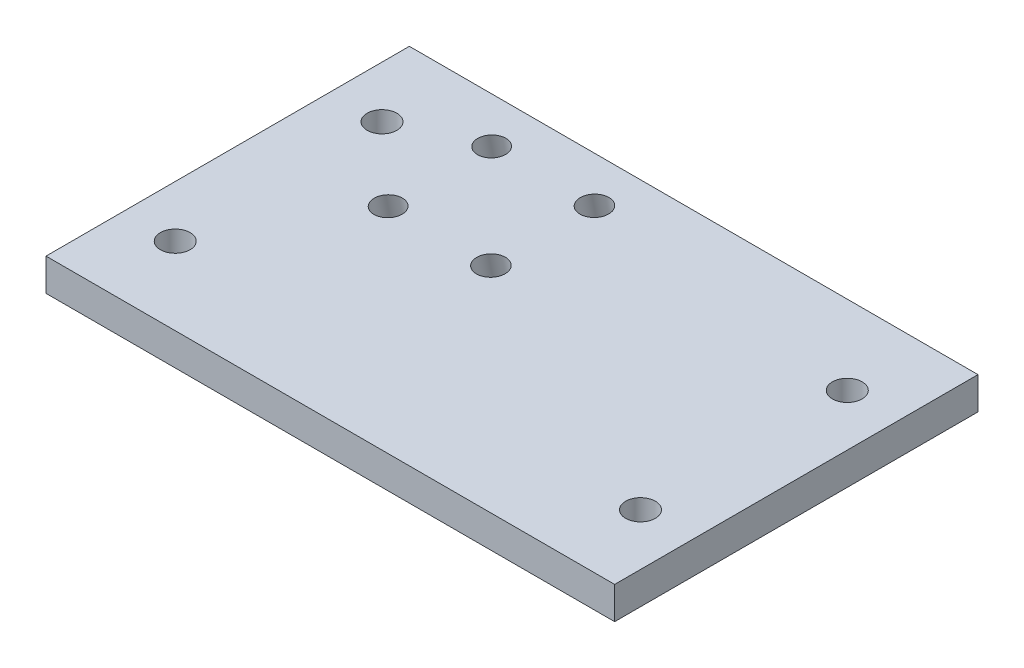
from build123d import *

# Parameters (mm, degrees)
SKETCH1_W           = 90
SKETCH1_H           = 56.23
BOSS_EXTRUDE1_DEPTH = 5
SKETCH2_R           = 2.3
CUT_EXTRUDE1_DEPTH  = 15
SKETCH7_R           = 2.3
CUT_EXTRUDE3_DEPTH  = 45
SKETCH9_W           = 61.183864123
SKETCH9_H           = 5.04390519
CUT_EXTRUDE4_DEPTH  = 2
SKETCH11_R          = 2.159579804
SKETCH11_R_2        = 2.2
SKETCH11_R_3        = 2.200145532
CUT_EXTRUDE5_DEPTH  = 20


with BuildPart() as part:
    # Sketch1 → Boss-Extrude1 (new body)
    with BuildSketch(Plane(origin=(0, 0, 0), x_dir=(1, 0, 0), z_dir=(0, 1, 0))):
        with Locations((45, 28.115)):
            Rectangle(SKETCH1_W, SKETCH1_H)
    extrude(amount=BOSS_EXTRUDE1_DEPTH)

    # Sketch2 → Cut-Extrude1 (cut)
    with BuildSketch(Plane(origin=(0, 5, 0), x_dir=(1, 0, 0), z_dir=(0, 1, 0))):
        with Locations((82, 12)):
            Circle(SKETCH2_R)
        with Locations((10, 12)):
            Circle(SKETCH2_R)
    extrude(amount=-CUT_EXTRUDE1_DEPTH, mode=Mode.SUBTRACT)

    # Sketch7 → Cut-Extrude3 (cut)
    with BuildSketch(Plane(origin=(0, 5, 0), x_dir=(1, 0, 0), z_dir=(0, 1, 0))):
        with Locations((82, 44)):
            Circle(SKETCH7_R)
        with Locations((10, 44)):
            Circle(SKETCH7_R)
    extrude(amount=-CUT_EXTRUDE3_DEPTH, mode=Mode.SUBTRACT)

    # Sketch9 → Cut-Extrude4 (cut)
    with BuildSketch(Plane.ZY):
        with Locations((-25.638067939, 2.521952595)):
            Rectangle(SKETCH9_W, SKETCH9_H)
    extrude(amount=-CUT_EXTRUDE4_DEPTH, mode=Mode.SUBTRACT)

    # Sketch11 → Cut-Extrude5 (cut)
    with BuildSketch(Plane(origin=(0, 4.817959636, 0.936516484), x_dir=(1, 0, 0), z_dir=(0, 0.9816271834476639, 0.19080899537654525))):
        with Locations((21.790317182, 49.227295285)):
            Circle(SKETCH11_R)
        with Locations((37.700491288, 49.227295285)):
            Circle(SKETCH11_R_2)
        with Locations((37.700491288, 33.498951741)):
            Circle(SKETCH11_R_3)
        with Locations((21.790317182, 33.498951741)):
            Circle(SKETCH11_R)
    extrude(amount=-CUT_EXTRUDE5_DEPTH, mode=Mode.SUBTRACT)


solid = part.part
